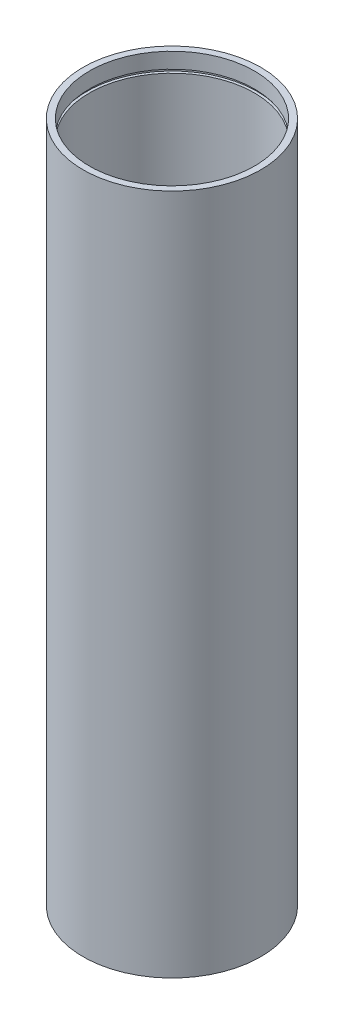
from build123d import *


with BuildPart() as part:
    # Sketch2 → Revolve1 (revolve)
    with BuildSketch(Plane.XY):
        Polygon((41.275, 331.4192), (41.275, 11.2522), (42.5958, 11.2522), (42.5958, 9.525), (41.275, 9.525), (41.275, 0), (44.45, 0), (44.45, 340.9442), (41.275, 340.9442), (41.275, 333.1464), (42.5958, 333.1464), (42.5958, 331.4192), align=None)
    revolve(axis=Axis((0, 0, 0), (0, 1, 0)))


solid = part.part
